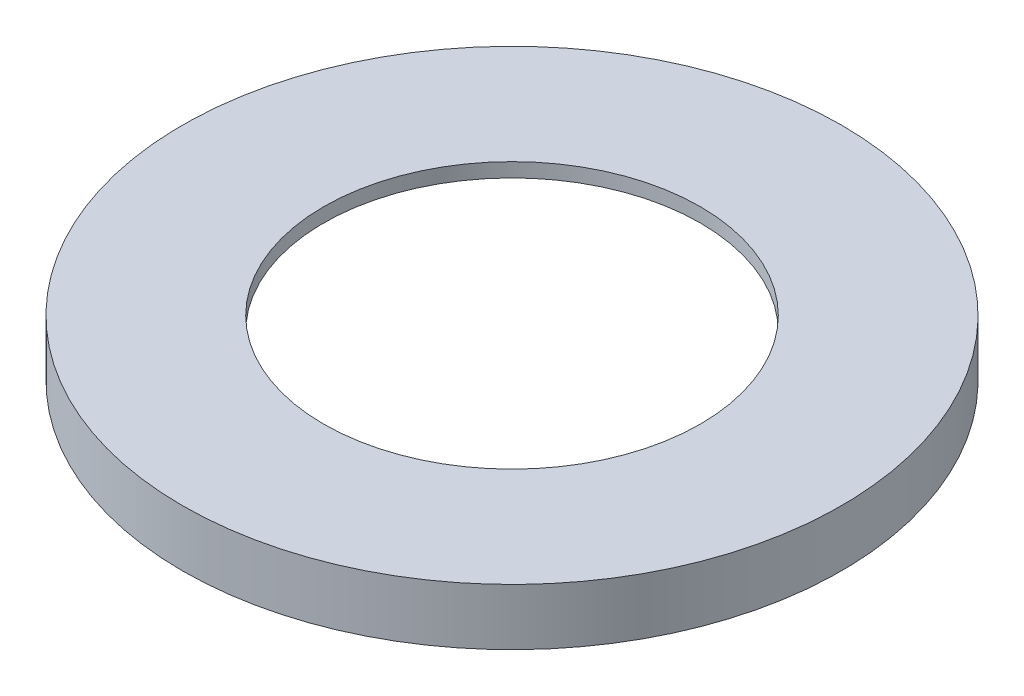
from build123d import *

# Parameters (mm, degrees)
SKETCH1_R           = 35
SKETCH1_R_2         = 20
BOSS_EXTRUDE1_DEPTH = 6
SKETCH2_W           = 11
SKETCH2_H           = 4.5


with BuildPart() as part:
    # Sketch1 → Boss-Extrude1 (new body)
    with BuildSketch(Plane(origin=(0, 0, 0), x_dir=(1, 0, 0), z_dir=(0, 1, 0))):
        Circle(SKETCH1_R)
        Circle(SKETCH1_R_2, mode=Mode.SUBTRACT)
    extrude(amount=BOSS_EXTRUDE1_DEPTH)

    # Sketch2 → Cut-Revolve1 (revolve, cut)
    with BuildSketch(Plane(origin=(0, 0, 0), x_dir=(0, 0, -1), z_dir=(1, 0, 0))):
        with Locations((-25.5, 2.25)):
            Rectangle(SKETCH2_W, SKETCH2_H)
    revolve(axis=Axis((0, 0, 0), (0, 1, 0)), mode=Mode.SUBTRACT)


solid = part.part
